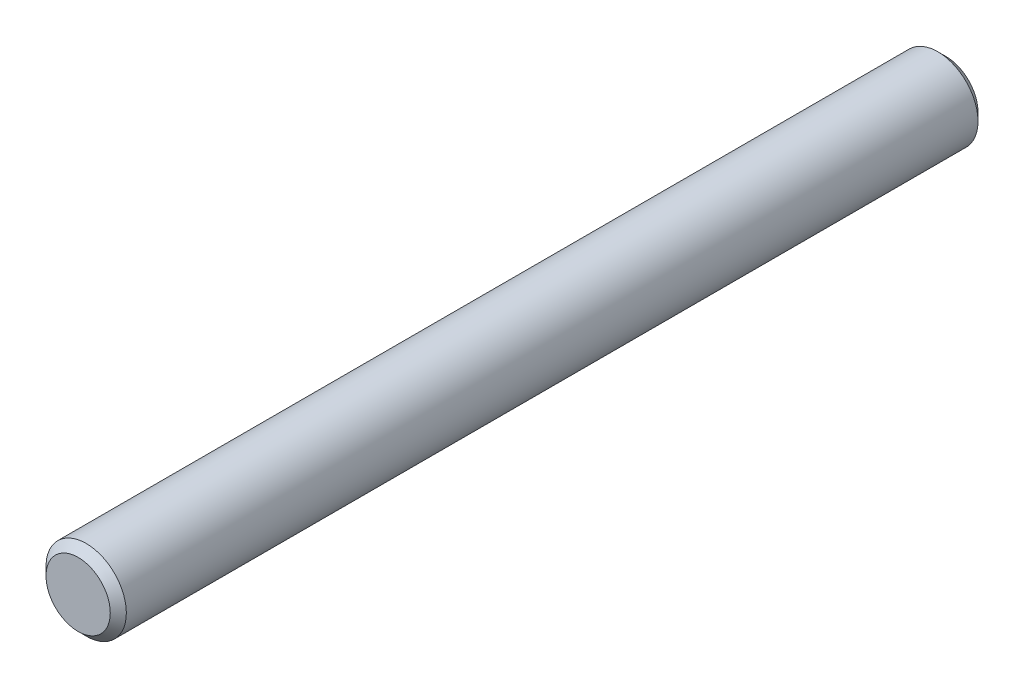
from build123d import *

# Parameters (mm, degrees)
SKETCH1_R      = 4.7625
EXTRUDE1_DEPTH = 51.435
CHAMFER1_SIZE  = 0.9525


with BuildPart() as part:
    # Sketch1 → Extrude1 (new, symmetric)
    with BuildSketch(Plane.XY):
        Circle(SKETCH1_R)
    extrude(amount=EXTRUDE1_DEPTH, both=True)

    # Chamfer1
    chamfer1_edges = [part.edges().sort_by_distance(p)[0] for p in [
        (-4.7625, 0, -51.435),
        (-4.7625, 0, 51.435),
    ]]
    chamfer(chamfer1_edges, length=CHAMFER1_SIZE)


solid = part.part
